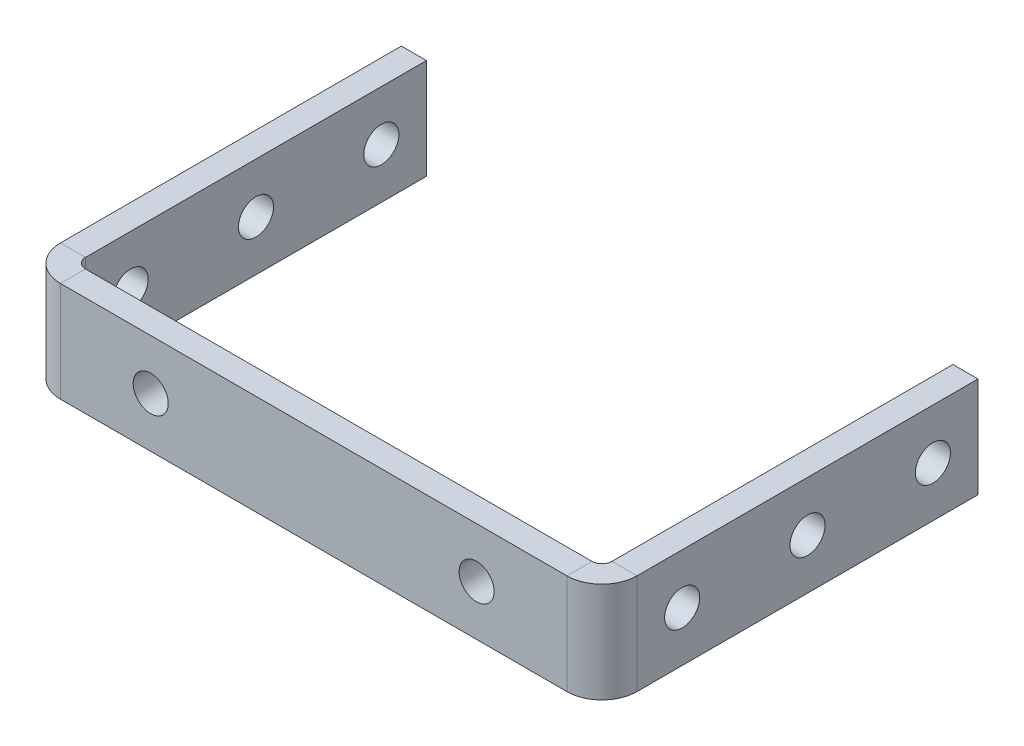
from build123d import *

# Parameters (mm, degrees)
SM_BASE_FLANGE_1_DEPTH = 40
CUT_EXTRUDE_1_REACH    = 195.197
SKETCH_6_R             = 7
CUT_EXTRUDE_2_REACH    = 274.213
SKETCH_7_R             = 7


# Sheet-metal steps are written as plain solids
with BuildPart() as part:
    # Sketch 1 → 基体-法兰1 (new body)
    with BuildSketch(Plane(origin=(0, 0, 0), x_dir=(1, 0, 0), z_dir=(0, 1, 0))):
        with BuildLine():
            Line((-105, 140), (-105, 4))
            ThreePointArc((-105, 4), (-103.828427125, 1.171572875), (-101, 0))
            Line((-101, 0), (101, 0))
            ThreePointArc((101, 0), (103.828427125, 1.171572875), (105, 4))
            Line((105, 4), (105, 140))
            Line((105, 140), (115, 140))
            Line((115, 140), (115, 4))
            ThreePointArc((115, 4), (110.899494937, -5.899494937), (101, -10))
            Line((101, -10), (-101, -10))
            ThreePointArc((-101, -10), (-110.899494937, -5.899494937), (-115, 4))
            Line((-115, 4), (-115, 140))
            Line((-115, 140), (-105, 140))
        make_face()
    extrude(amount=SM_BASE_FLANGE_1_DEPTH)

    # 草图6 → 切除-拉伸1 (cut, up to next)
    with BuildSketch(Plane.XY.offset(10), mode=Mode.PRIVATE) as cut_extrude_1_sk1:
        with Locations((-65, 20)):
            Circle(SKETCH_6_R)
    cut_extrude_1_tool1 = extrude(cut_extrude_1_sk1.sketch, amount=-CUT_EXTRUDE_1_REACH, mode=Mode.PRIVATE) & part.part
    # 草图6 → 切除-拉伸1 (cut, up to next)
    with BuildSketch(Plane.XY.offset(10), mode=Mode.PRIVATE) as cut_extrude_1_sk2:
        with Locations((65, 20)):
            Circle(SKETCH_6_R)
    cut_extrude_1_tool2 = extrude(cut_extrude_1_sk2.sketch, amount=-CUT_EXTRUDE_1_REACH, mode=Mode.PRIVATE) & part.part
    add(cut_extrude_1_tool1.solids().sort_by_distance((-65, 20, 10))[0], mode=Mode.SUBTRACT)
    add(cut_extrude_1_tool2.solids().sort_by_distance((65, 20, 10))[0], mode=Mode.SUBTRACT)

    # 切除-拉伸2: up to this face of the body (flat: up to its plane)
    cut_extrude_2_end = Plane(part.part.faces().sort_by_distance((-115, 20, -72))[0])
    # 草图7 → 切除-拉伸2 (cut, up to the picked face)
    with BuildSketch(Plane(origin=(115, 0, 0), x_dir=(0, 0, -1), z_dir=(1, 0, 0)), mode=Mode.PRIVATE) as cut_extrude_2_sk1:
        with Locations((122, 20)):
            Circle(SKETCH_7_R)
    cut_extrude_2_tool1 = split(extrude(cut_extrude_2_sk1.sketch, amount=-CUT_EXTRUDE_2_REACH, mode=Mode.PRIVATE), bisect_by=cut_extrude_2_end, keep=Keep.BOTH, mode=Mode.PRIVATE)
    # 草图7 → 切除-拉伸2 (cut, up to the picked face)
    with BuildSketch(Plane(origin=(115, 0, 0), x_dir=(0, 0, -1), z_dir=(1, 0, 0)), mode=Mode.PRIVATE) as cut_extrude_2_sk2:
        with Locations((72, 20)):
            Circle(SKETCH_7_R)
    cut_extrude_2_tool2 = split(extrude(cut_extrude_2_sk2.sketch, amount=-CUT_EXTRUDE_2_REACH, mode=Mode.PRIVATE), bisect_by=cut_extrude_2_end, keep=Keep.BOTH, mode=Mode.PRIVATE)
    # 草图7 → 切除-拉伸2 (cut, up to the picked face)
    with BuildSketch(Plane(origin=(115, 0, 0), x_dir=(0, 0, -1), z_dir=(1, 0, 0)), mode=Mode.PRIVATE) as cut_extrude_2_sk3:
        with Locations((22, 20)):
            Circle(SKETCH_7_R)
    cut_extrude_2_tool3 = split(extrude(cut_extrude_2_sk3.sketch, amount=-CUT_EXTRUDE_2_REACH, mode=Mode.PRIVATE), bisect_by=cut_extrude_2_end, keep=Keep.BOTH, mode=Mode.PRIVATE)
    add(cut_extrude_2_tool1.solids().sort_by(Axis((115, 20, -122), (-1, 0, 0)))[0], mode=Mode.SUBTRACT)
    add(cut_extrude_2_tool2.solids().sort_by(Axis((115, 20, -72), (-1, 0, 0)))[0], mode=Mode.SUBTRACT)
    add(cut_extrude_2_tool3.solids().sort_by(Axis((115, 20, -22), (-1, 0, 0)))[0], mode=Mode.SUBTRACT)


solid = part.part
